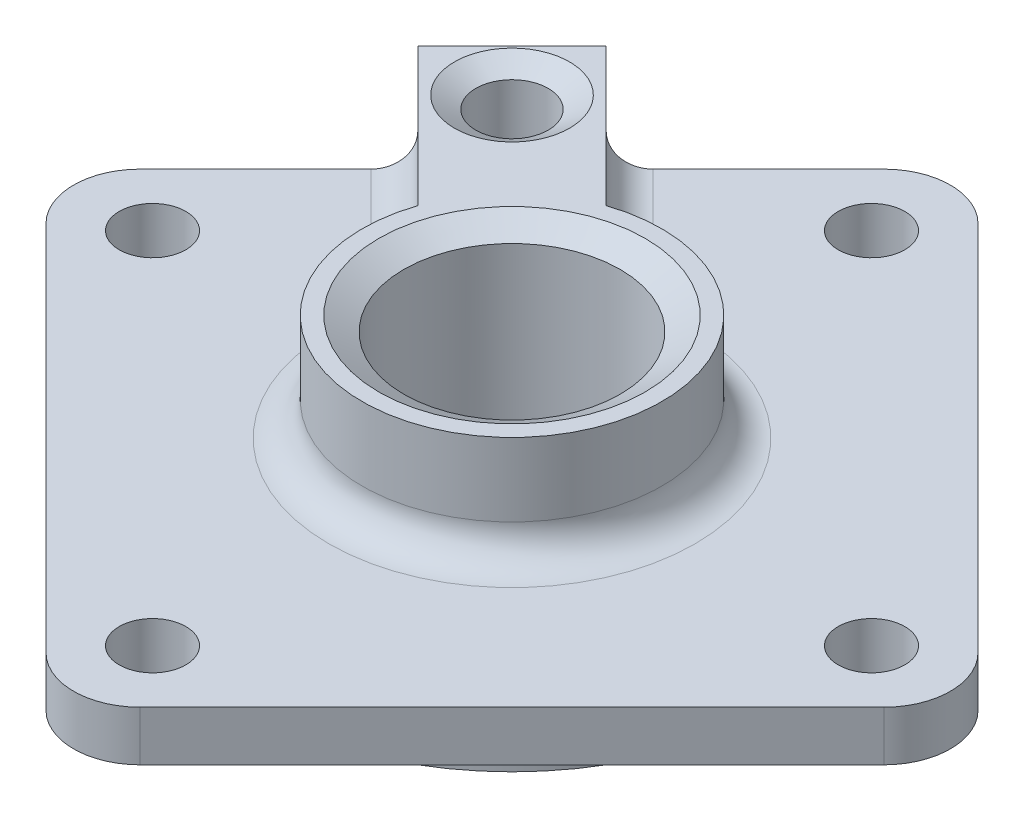
from build123d import *

# Parameters (mm, degrees)
CUT_EXTRUDE4_DEPTH           = 66.955911542
CUT_EXTRUDE4_DEPTH_BACK      = 66.955911542
SKETCH3_R                    = 3.175
FILLET3_R                    = 6.35
BOSS_EXTRUDE1_START          = 9.8044
BOSS_EXTRUDE1_DEPTH          = 10.16
FILLET2_R                    = 3.175
CHAMFER2_SIZE                = 2.38125
CHAMFER2_SIZE_2              = 1.374815329
CUT_EXTRUDE3_DEPTH           = 63.420823637
CUT_EXTRUDE3_DEPTH_BACK      = 63.420823637
SKETCH8_R                    = 0.79375
F_5_16_24_TAPPED_HOLE1_D     = 6.9088
F_5_16_24_TAPPED_HOLE1_DEPTH = 12.7
F_5_16_24_TAPPED_HOLE1_TIP   = 2.075612922
CHAMFER3_SIZE                = 2.032
CHAMFER3_SIZE2               = 1.173175747


with BuildPart() as part:
    # Sketch1 → Revolve1 (revolve)
    with BuildSketch(Plane.XY, mode=Mode.PRIVATE) as revolve1_sk:
        Polygon((10.31875, 19.9644), (14.2875, 19.9644), (14.2875, 9.8044), (44.45, 9.8044), (44.45, 5.0419), (28.575, 5.0419), (25.1206, 1.5875), (25.1206, 0), (10.31875, 0), align=None)
    revolve(revolve1_sk.sketch.rotate(Axis((0, 0, 0), (0, 1, 0)), 90), axis=Axis((0, 0, 0), (0, 1, 0)))

    # Sketch3 → Cut-Extrude4 (cut, two sides: drawn at the far end of the back side and taken through both)
    with BuildSketch(Plane(origin=(0, 0, 0), x_dir=(1, 0, 0), z_dir=(0, 1, 0)).offset(-CUT_EXTRUDE4_DEPTH_BACK)):
        with BuildLine():
            Line((0, -44.45), (-44.45, 0))
            ThreePointArc((-44.45, 0), (-31.430896424, -31.430896424), (0, -44.45))
        make_face()
        with BuildLine():
            Line((44.45, 0), (0, -44.45))
            ThreePointArc((0, -44.45), (31.430896424, -31.430896424), (44.45, 0))
        make_face()
        with BuildLine():
            ThreePointArc((44.45, 0), (31.430896424, 31.430896424), (0, 44.45))
            Line((0, 44.45), (44.45, 0))
        make_face()
        with BuildLine():
            ThreePointArc((0, 44.45), (-31.430896424, 31.430896424), (-44.45, 0))
            Line((-44.45, 0), (0, 44.45))
        make_face()
        with Locations(Location((-34.29, 0, 0), (0, 0, 270))):
            Circle(SKETCH3_R)
        with Locations(Location((0, 34.29, 0), (0, 0, 270))):
            Circle(SKETCH3_R)
        with Locations(Location((34.29, 0, 0), (0, 0, 270))):
            Circle(SKETCH3_R)
        with Locations(Location((0, -34.29, 0), (0, 0, 270))):
            Circle(SKETCH3_R)
    extrude(amount=CUT_EXTRUDE4_DEPTH + CUT_EXTRUDE4_DEPTH_BACK, mode=Mode.SUBTRACT)

    # Fillet3
    fillet3_edges = [part.edges().sort_by_distance(p)[0] for p in [
        (0, 7.42315, -44.45),
        (44.45, 7.42315, 0),
        (0, 7.42315, 44.45),
        (-44.45, 7.42315, 0),
    ]]
    fillet(fillet3_edges, radius=FILLET3_R)

    # Sketch4 → Boss-Extrude1 (add)
    with BuildSketch(Plane(origin=(0, 0, 0), x_dir=(1, 0, 0), z_dir=(0, 1, 0)).offset(BOSS_EXTRUDE1_START)):
        Polygon((-22.225, 22.225), (-26.715128061, 17.734871939), (-11.786586159, 2.806330038), (-2.806330038, 11.786586159), (-17.734871939, 26.715128061), align=None)
    extrude(amount=BOSS_EXTRUDE1_DEPTH)

    # Fillet2
    fillet2_edges = [part.edges().sort_by_distance(p)[0] for p in [
        (10.102788136, 9.8044, 10.102788136),
        (-11.147443158, 9.8044, -20.127699279),
        (-20.127699279, 9.8044, -11.147443158),
    ]]
    fillet(fillet2_edges, radius=FILLET2_R)

    # Chamfer2
    # the kernel refuses this chamfer: 2.38125, 1.374815329 mm, written as the material it takes off along each edge
    with BuildSketch(Plane(origin=(0, 19.9644, 0), x_dir=(0, 0, -1), z_dir=(1, 0, 0))) as chamfer2_piece_1:
        Polygon((10.31875 + CHAMFER2_SIZE, 0), (10.31875, -CHAMFER2_SIZE_2), (10.31875, 0), align=None)
    revolve(axis=Axis((0, 19.9644, 0), (0, 1, 0)), revolution_arc=45.000000179, mode=Mode.SUBTRACT)
    with BuildSketch(Plane(origin=(0, 19.9644, 0), x_dir=(-0.7071067833935745, 0, -0.7071067789795206), z_dir=(0.7071067789795206, 0, -0.7071067833935745))) as chamfer2_piece_2:
        Polygon((10.31875 + CHAMFER2_SIZE, 0), (10.31875, -CHAMFER2_SIZE_2), (10.31875, 0), align=None)
    revolve(axis=Axis((0, 19.9644, 0), (0, 1, 0)), revolution_arc=314.999999821, mode=Mode.SUBTRACT)

    # Sketch8 → Cut-Extrude3 (cut, two sides: drawn at the far end of the back side and taken through both)
    with BuildSketch(Plane(origin=(0, 0, 0), x_dir=(1, 0, 0), z_dir=(0, 1, 0)).offset(-CUT_EXTRUDE3_DEPTH_BACK)):
        with Locations(Location((-17.06248663, 17.06248663, 0), (0, 0, 270))):
            Circle(SKETCH8_R)
    extrude(amount=CUT_EXTRUDE3_DEPTH + CUT_EXTRUDE3_DEPTH_BACK, mode=Mode.SUBTRACT)

    # 5/16-24 Tapped Hole1
    with Locations(Plane(origin=(0, 19.9644, 0), x_dir=(1, 0, 0), z_dir=(0, 1, 0))):
        with Locations((-18.183884746, 18.183884746)):
            Hole(F_5_16_24_TAPPED_HOLE1_D / 2, depth=F_5_16_24_TAPPED_HOLE1_DEPTH)
            with Locations((0, 0, -(F_5_16_24_TAPPED_HOLE1_DEPTH + F_5_16_24_TAPPED_HOLE1_TIP / 2))):  # 118° drill point
                Cone(0, F_5_16_24_TAPPED_HOLE1_D / 2, F_5_16_24_TAPPED_HOLE1_TIP, mode=Mode.SUBTRACT)

    # Chamfer3
    chamfer3_edges = [part.edges().sort_by_distance(p)[0] for p in [
        (-14.729484746, 19.9644, -18.183884746),
    ]]
    chamfer3_side = [part.faces().sort_by_distance(p)[0] for p in [
        (-9.027932252, 19.9644, -9.027932252),
    ]]
    chamfer(chamfer3_edges, length=CHAMFER3_SIZE, length2=CHAMFER3_SIZE2, reference=chamfer3_side[0])


solid = part.part
